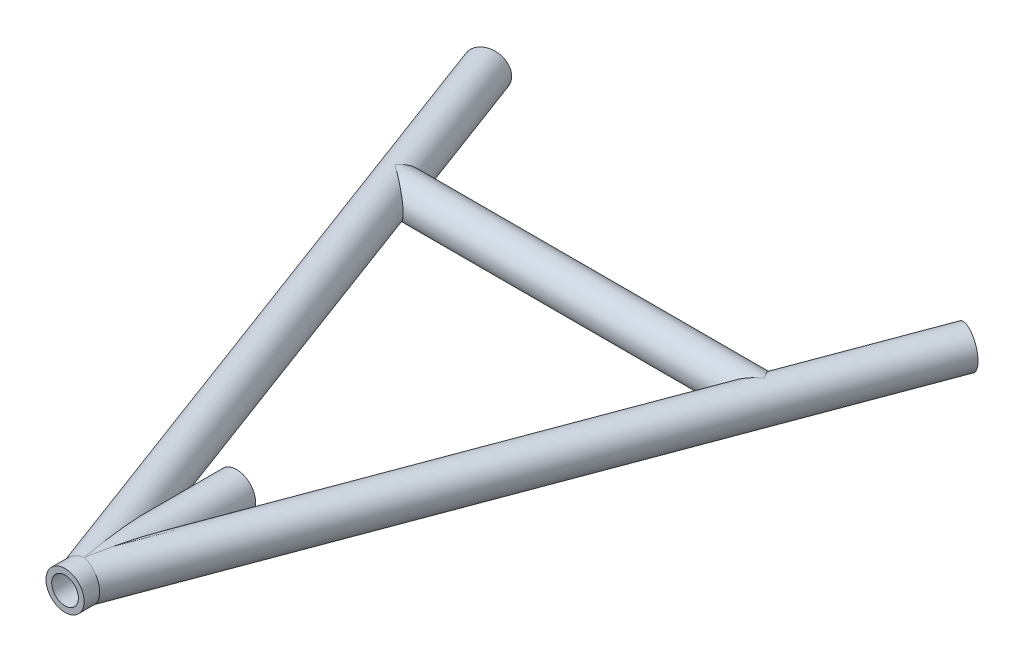
from build123d import *

# Parameters (mm, degrees)
SWEEP1_PROFILE_R   = 5
SWEEP4_PROFILE_R   = 5
SWEEP5_PROFILE_R   = 5
SPLIT1_START       = 5
SPLIT1_OUTLINE_W   = 10
SPLIT1_OUTLINE_H   = 12
SPLIT1_DEPTH       = 9.304379119
SKETCH37_R         = 3.5
CUT_EXTRUDE1_DEPTH = 49
SKETCH38_R         = 3.5
CUT_EXTRUDE2_DEPTH = 132
SKETCH39_R         = 3.5
CUT_EXTRUDE3_DEPTH = 132


# Read off the part's stored shape, not the designer's step: Split1
with BuildPart() as part:
    # Sweep1: sweep along a path in Sketch1
    with BuildLine(Plane(origin=(0, 0, 0), x_dir=(1, 0, 0), z_dir=(0, 1, 0))) as sweep1_path:
        Line((-62.917795488, 168.645637391), (0, 0))
        Line((0, 0), (62.917795488, 168.645637391))
    # Sweep1 profile (on start of the path) → Sweep1 (sweep)
    with BuildSketch(Plane(origin=(-62.917795488, 0, -168.645637391), x_dir=(0.936920207726199, 0, -0.349543308267082), z_dir=(0.349543308267082, 0, 0.936920207726199))):
        Circle(SWEEP1_PROFILE_R)
    sweep(path=sweep1_path.line, transition=Transition.RIGHT)

    # Sweep4: sweep along a path in Sketch1<7>
    with BuildLine(Plane(origin=(0, 0, 0), x_dir=(1, 0, 0), z_dir=(0, 1, 0))) as sweep4_path:
        Line((0, 40), (0, -5))
    # Sweep4 profile (on start of the path) → Sweep4 (sweep)
    with BuildSketch(Plane.XY.offset(-40)):
        Circle(SWEEP4_PROFILE_R)
    sweep(path=sweep4_path.line)

    # Sweep5: sweep along a path in Sketch1<8>
    with BuildLine(Plane(origin=(0, 0, 0), x_dir=(1, 0, 0), z_dir=(0, 1, 0))) as sweep5_path:
        Line((48.5, 130), (-48.5, 130))
    # Sweep5 profile (on start of the path) → Sweep5 (sweep)
    with BuildSketch(Plane(origin=(48.5, 0, -130), x_dir=(0, 0, -1), z_dir=(-1, 0, 0))):
        Circle(SWEEP5_PROFILE_R)
    sweep(path=sweep5_path.line)

    # Split1 outline → Split1 (cut)
    with BuildSketch(Plane.XY.offset(SPLIT1_START)):
        Rectangle(SPLIT1_OUTLINE_W, SPLIT1_OUTLINE_H)
    extrude(amount=SPLIT1_DEPTH, mode=Mode.SUBTRACT)

    # Sketch37 → Cut-Extrude1 (cut)
    with BuildSketch(Plane.XY.offset(5)):
        Circle(SKETCH37_R)
    extrude(amount=-CUT_EXTRUDE1_DEPTH, mode=Mode.SUBTRACT)

    # Sketch38 → Cut-Extrude2 (cut)
    with BuildSketch(Plane(origin=(-62.917795488, 0, -168.645637391), x_dir=(-0.9369202077261991, 0, 0.34954330826708174), z_dir=(-0.34954330826708174, 0, -0.9369202077261991))):
        Circle(SKETCH38_R)
    extrude(amount=-CUT_EXTRUDE2_DEPTH, mode=Mode.SUBTRACT)

    # Sketch39 → Cut-Extrude3 (cut)
    with BuildSketch(Plane(origin=(62.917795488, 0, -168.645637391), x_dir=(-0.9369202077261989, 0, -0.3495433082670822), z_dir=(0.3495433082670822, 0, -0.9369202077261989))):
        Circle(SKETCH39_R)
    extrude(amount=-CUT_EXTRUDE3_DEPTH, mode=Mode.SUBTRACT)


solid = part.part
